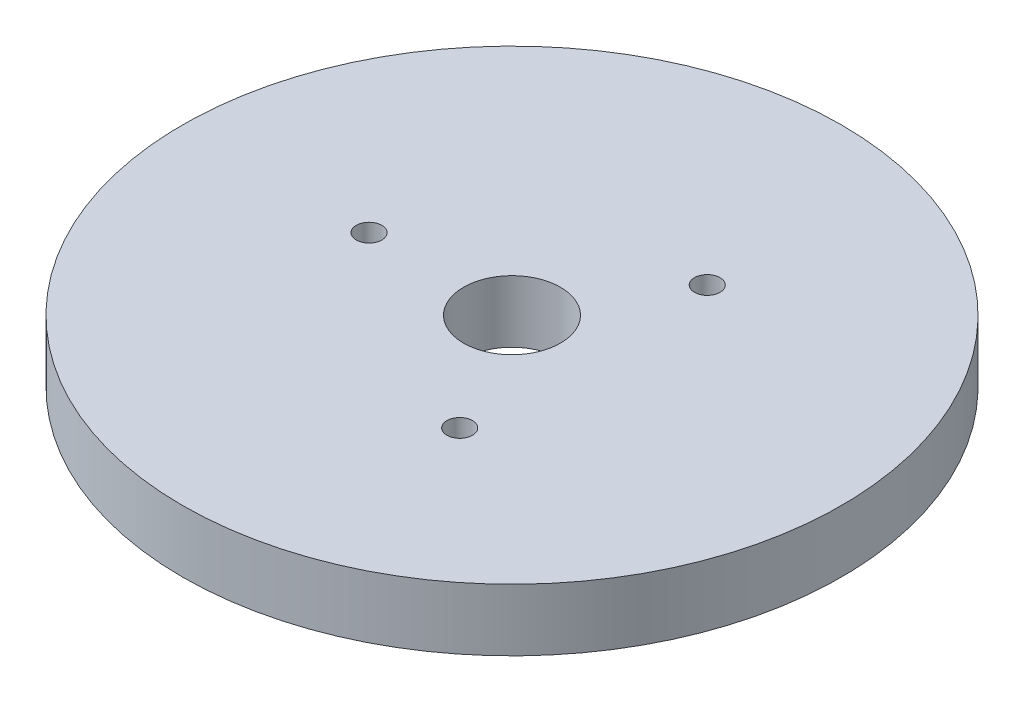
from build123d import *

# Parameters (mm, degrees)
SKETCH1_R           = 85
BOSS_EXTRUDE1_DEPTH = 16
SKETCH2_R           = 12.5
CUT_EXTRUDE1_DEPTH  = 122.268297588
SKETCH3_R           = 3.294684627
CUT_EXTRUDE2_DEPTH  = 12.997779502
CIRPATTERN1_COUNT   = 3


with BuildPart() as part:
    # Sketch1 → Boss-Extrude1 (new body)
    with BuildSketch(Plane(origin=(0, 0, 0), x_dir=(1, 0, 0), z_dir=(0, 1, 0))):
        Circle(SKETCH1_R)
    extrude(amount=BOSS_EXTRUDE1_DEPTH)

    # Sketch2 → Cut-Extrude1 (cut, through all)
    with BuildSketch(Plane(origin=(0, 0, 0), x_dir=(1, 0, 0), z_dir=(0, 1, 0))):
        Circle(SKETCH2_R)
    extrude(amount=CUT_EXTRUDE1_DEPTH, mode=Mode.SUBTRACT)

    # Sketch3 → Cut-Extrude2 (cut)
    with BuildSketch(Plane(origin=(0, 16, 0), x_dir=(1, 0, 0), z_dir=(0, 1, 0))):
        with Locations((-36.866376714, 0)):
            Circle(SKETCH3_R)
    cut_extrude2 = extrude(amount=-CUT_EXTRUDE2_DEPTH, mode=Mode.SUBTRACT)

    # CirPattern1: Cut-Extrude2 ×3 about axis
    cirpattern1_axis = Axis((0, 0, 0), (0, 1, 0))
    for i in range(1, CIRPATTERN1_COUNT):
        add(cut_extrude2.rotate(cirpattern1_axis, i * 360 / CIRPATTERN1_COUNT), mode=Mode.SUBTRACT)


solid = part.part
